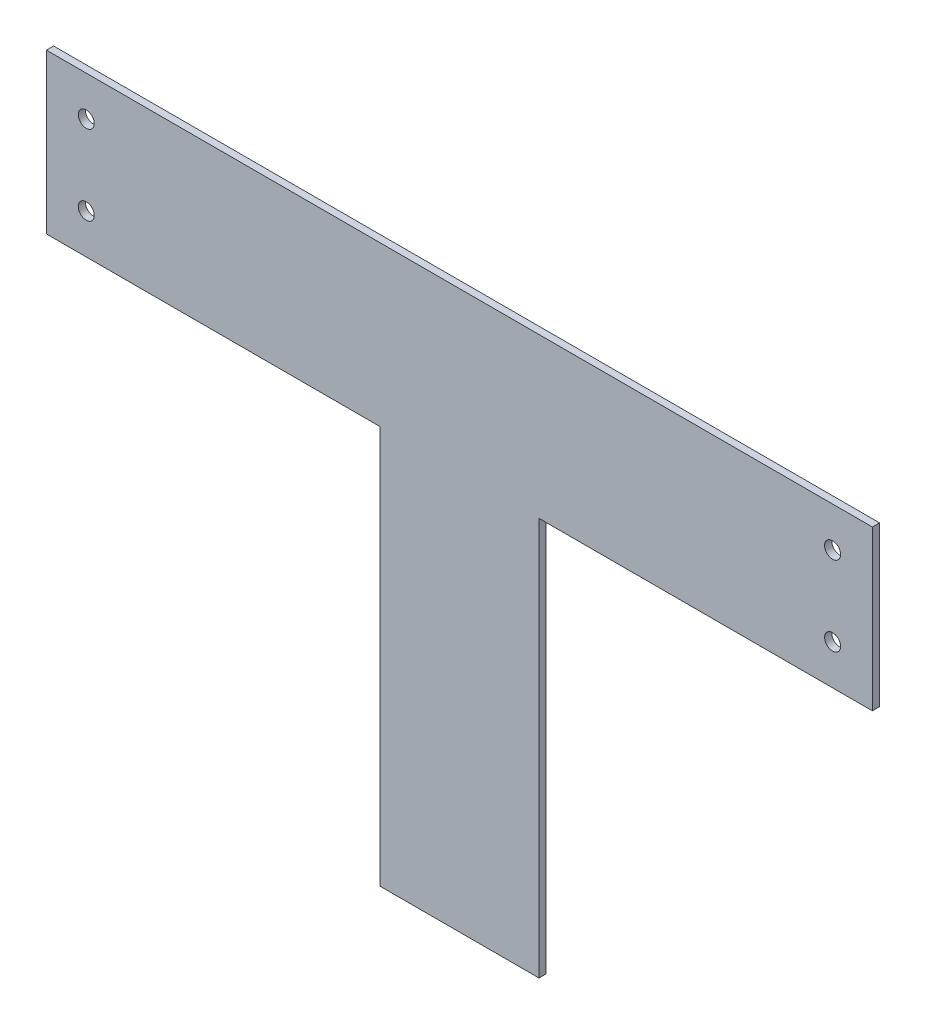
from build123d import *

# Parameters (mm, degrees)
BOSS_EXTRUDE1_DEPTH    = 1.143
F_10_CLEARANCE_HOLE1_D = 5.1054


with BuildPart() as part:
    # Sketch1 → Boss-Extrude1 (new, symmetric)
    with BuildSketch(Plane.XY):
        Polygon((131.7625, 25.4), (-131.7625, 25.4), (-131.7625, -25.4), (-25.4, -25.4), (-25.4, -152.4), (25.4, -152.4), (25.4, -25.4), (131.7625, -25.4), align=None)
    extrude(amount=BOSS_EXTRUDE1_DEPTH, both=True)

    # #10 Clearance Hole1 (through all)
    with Locations(Plane.XY.offset(1.143)):
        with Locations((-119.0625, 12.7), (-119.0625, -12.7)):
            f_10_clearance_hole1 = Hole(F_10_CLEARANCE_HOLE1_D / 2)

    # Mirror1: #10 Clearance Hole1 across plane
    add(f_10_clearance_hole1.mirror(Plane(origin=(0, 0, 0), x_dir=(0, 0, 1), z_dir=(1, 0, 0))), mode=Mode.SUBTRACT)


solid = part.part
